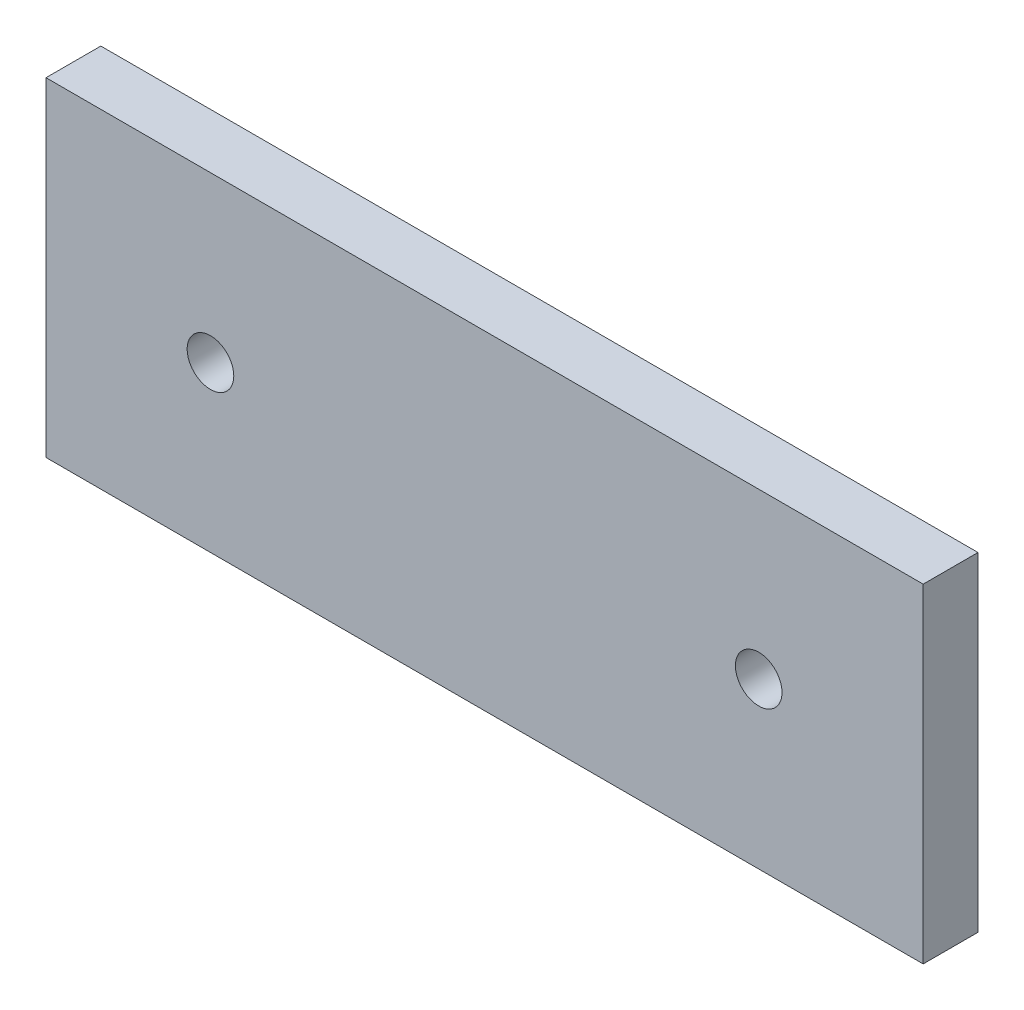
from build123d import *

# Parameters (mm, degrees)
SKETCH_1_W      = 64
SKETCH_1_H      = 24
SKETCH_1_R      = 1.7
EXTRUDE_1_DEPTH = 2


with BuildPart() as part:
    # 草图1 → 凸台-拉伸1 (new, symmetric)
    with BuildSketch(Plane.XY):
        with Locations((20, 0)):
            Rectangle(SKETCH_1_W, SKETCH_1_H)
        Circle(SKETCH_1_R, mode=Mode.SUBTRACT)
        with Locations((40, 0)):
            Circle(SKETCH_1_R, mode=Mode.SUBTRACT)
    extrude(amount=EXTRUDE_1_DEPTH, both=True)


solid = part.part
